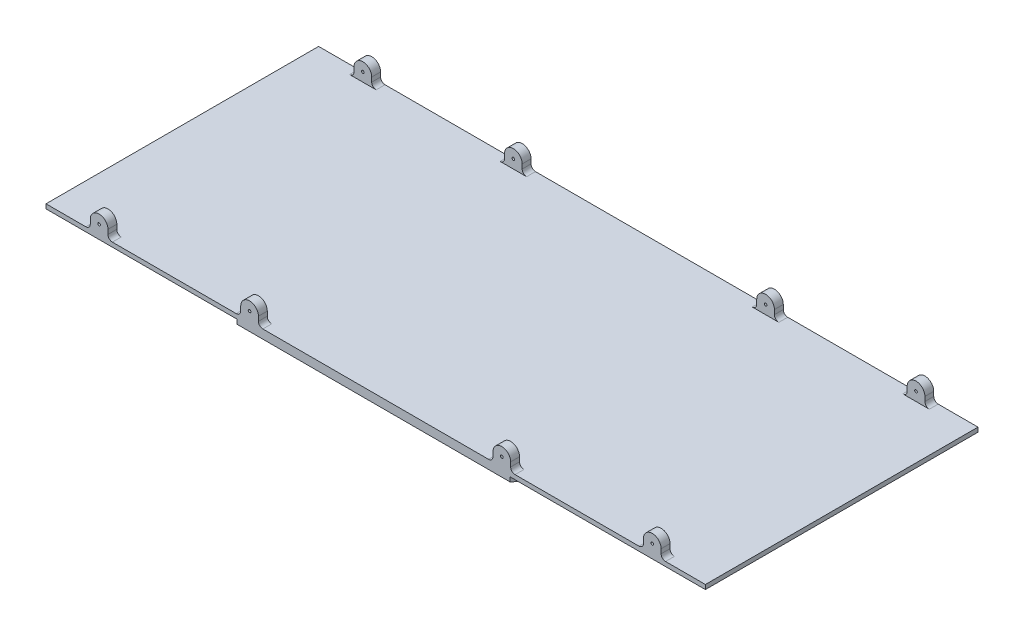
from build123d import *

# Parameters (mm, degrees)
THICKEN2_START      = 118.58
THICKEN2_OUTLINE_W  = 5
THICKEN2_OUTLINE_H  = 308
THICKEN2_DEPTH      = 745
BOSS_EXTRUDE1_DEPTH = 10
SKETCH3_R           = 1.5
CUT_EXTRUDE1_DEPTH  = 298
FILLET1_R           = 5
FILLET2_R           = 5
BOSS_EXTRUDE2_DEPTH = 5
SKETCH5_R           = 98.944012136
SKETCH5_R_2         = 88.132026091
CUT_EXTRUDE2_DEPTH  = 2


# Read off the part's stored shape, not the designer's step: Thicken2
with BuildPart() as part:
    # Thicken2 outline → Thicken2 (new body)
    with BuildSketch(Plane.YZ.offset(THICKEN2_START)):
        with Locations((347.987717935, 154)):
            Rectangle(THICKEN2_OUTLINE_W, THICKEN2_OUTLINE_H)
    extrude(amount=THICKEN2_DEPTH)

    # Sketch2 → Boss-Extrude1 (add)
    with BuildSketch(Plane.XY.offset(308)):
        with BuildLine():
            Line((168.58, 350.487717935), (168.58, 360.487717935))
            ThreePointArc((168.58, 360.487717935), (178.58, 370.487717935), (188.58, 360.487717935))
            Line((188.58, 360.487717935), (188.58, 350.487717935))
            Line((188.58, 350.487717935), (168.58, 350.487717935))
        make_face()
        with BuildLine():
            Line((338.58, 350.487717935), (338.58, 360.487717935))
            ThreePointArc((338.58, 360.487717935), (348.58, 370.487717935), (358.58, 360.487717935))
            Line((358.58, 360.487717935), (358.58, 350.487717935))
            Line((358.58, 350.487717935), (338.58, 350.487717935))
        make_face()
        with BuildLine():
            Line((623.58, 350.487717935), (623.58, 360.487717935))
            ThreePointArc((623.58, 360.487717935), (633.58, 370.487717935), (643.58, 360.487717935))
            Line((643.58, 360.487717935), (643.58, 350.487717935))
            Line((643.58, 350.487717935), (623.58, 350.487717935))
        make_face()
        with BuildLine():
            Line((793.58, 350.487717935), (793.58, 360.487717935))
            ThreePointArc((793.58, 360.487717935), (803.58, 370.487717935), (813.58, 360.487717935))
            Line((813.58, 360.487717935), (813.58, 350.487717935))
            Line((813.58, 350.487717935), (793.58, 350.487717935))
        make_face()
    boss_extrude1 = extrude(amount=-BOSS_EXTRUDE1_DEPTH)

    # Sketch3 → Cut-Extrude1 (cut)
    with BuildSketch(Plane.XY.offset(308)):
        with Locations((178.58, 360.487717935)):
            Circle(SKETCH3_R)
        with Locations((348.58, 360.487717935)):
            Circle(SKETCH3_R)
        with Locations((633.58, 360.487717935)):
            Circle(SKETCH3_R)
        with Locations((803.58, 360.487717935)):
            Circle(SKETCH3_R)
    cut_extrude1 = extrude(amount=-CUT_EXTRUDE1_DEPTH, mode=Mode.SUBTRACT)

    # Fillet1
    fillet1_edges = [part.edges().sort_by_distance(p)[0] for p in [
        (188.58, 350.487717935, 303),
        (168.58, 350.487717935, 303),
        (358.58, 350.487717935, 303),
        (338.58, 350.487717935, 303),
        (643.58, 350.487717935, 303),
        (623.58, 350.487717935, 303),
        (813.58, 350.487717935, 303),
        (793.58, 350.487717935, 303),
    ]]
    fillet(fillet1_edges, radius=FILLET1_R)

    # Mirror2: Boss-Extrude1 across plane
    add(boss_extrude1.mirror(Plane.XY.offset(154)))

    # Mirror3: Cut-Extrude1 across plane
    add(cut_extrude1.mirror(Plane.XY.offset(154)), mode=Mode.SUBTRACT)

    # Fillet2
    fillet2_edges = [part.edges().sort_by_distance(p)[0] for p in [
        (168.58, 350.487717935, 5),
        (188.58, 350.487717935, 5),
        (338.58, 350.487717935, 5),
        (358.58, 350.487717935, 5),
        (623.58, 350.487717935, 5),
        (643.58, 350.487717935, 5),
        (793.58, 350.487717935, 5),
        (813.58, 350.487717935, 5),
    ]]
    fillet(fillet2_edges, radius=FILLET2_R)

    # Sketch4 → Boss-Extrude2 (add)
    with BuildSketch(Plane.XZ.offset(-345.487717935)):
        with BuildLine():
            Line((334.162131755, 308), (642.69967146, 308))
            ThreePointArc((642.69967146, 308), (706.409922047, 154), (642.69967146, 0))
            Line((642.69967146, 0), (334.162131755, 0))
            ThreePointArc((334.162131755, 0), (270.451881168, 154), (334.162131755, 308))
        make_face()
    extrude(amount=BOSS_EXTRUDE2_DEPTH)

    # Sketch5 → Cut-Extrude2 (cut)
    with BuildSketch(Plane.XZ.offset(-340.487717935)):
        with Locations(Location((482.249672024, 154, 0), (0, 0, 270))):
            Circle(SKETCH5_R)
        with Locations(Location((482.249672024, 154, 0), (0, 0, 270))):
            Circle(SKETCH5_R_2, mode=Mode.SUBTRACT)
    extrude(amount=-CUT_EXTRUDE2_DEPTH, mode=Mode.SUBTRACT)


solid = part.part
